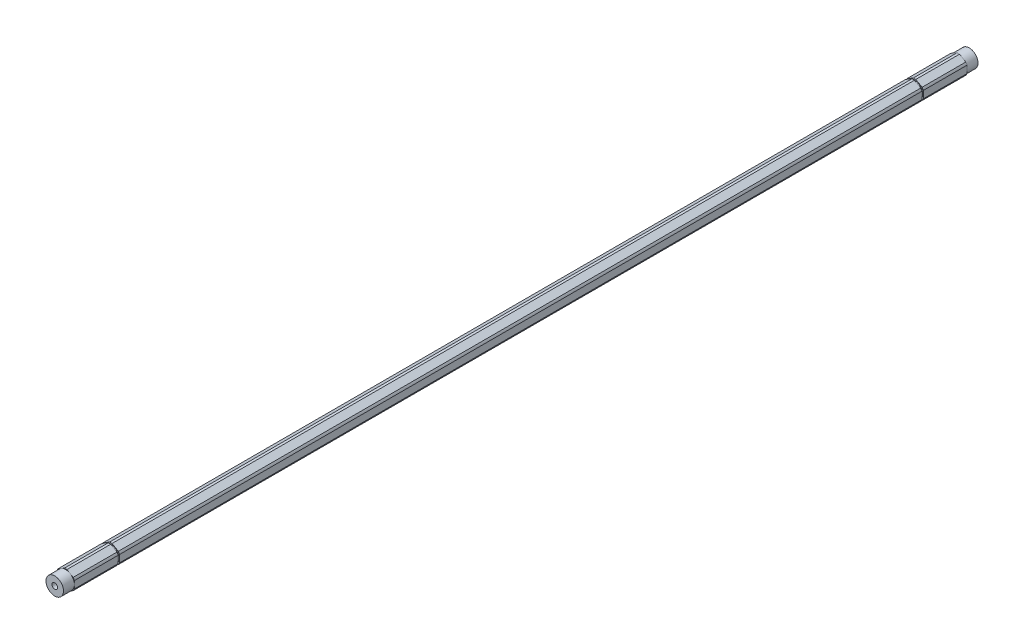
from build123d import *

# Parameters (mm, degrees)
SKETCH1_R                            = 2.0193
BOSS_EXTRUDE1_DEPTH                  = 331.7875
SKETCH2_R                            = 8.89
SKETCH2_R_2                          = 6.35
CUT_EXTRUDE_THIN1_DEPTH              = 7.9375
SKETCH3_W                            = 2.67360648
SKETCH3_H                            = 0.9906
F_10_32_TAPPED_HOLE1_D               = 4.0386
F_10_32_TAPPED_HOLE1_DEPTH           = 12.02944
F_10_32_TAPPED_HOLE1_TIP             = 1.213317848
F_10_32_TAPPED_HOLE1_ON_FACE_2_D     = 4.0386
F_10_32_TAPPED_HOLE1_ON_FACE_2_DEPTH = 12.02944
F_10_32_TAPPED_HOLE1_ON_FACE_2_TIP   = 1.213317848


with BuildPart() as part:
    # Sketch1 → Boss-Extrude1 (new, symmetric)
    with BuildSketch(Plane.XY):
        with BuildLine():
            ThreePointArc((0.893039571, 6.816751782), (0, 6.874999966), (-0.893039571, 6.816751782))
            Line((-0.893039571, 6.816751782), (-5.456960429, 4.181770846))
            ThreePointArc((-5.456960429, 4.181770846), (-5.953924622, 3.437499983), (-6.35, 2.634980936))
            Line((-6.35, 2.634980936), (-6.35, -2.634980936))
            ThreePointArc((-6.35, -2.634980936), (-5.953924622, -3.437499983), (-5.456960429, -4.181770846))
            Line((-5.456960429, -4.181770846), (-0.893039571, -6.816751782))
            ThreePointArc((-0.893039571, -6.816751782), (0, -6.874999966), (0.893039571, -6.816751782))
            Line((0.893039571, -6.816751782), (5.456960429, -4.181770846))
            ThreePointArc((5.456960429, -4.181770846), (5.953924622, -3.437499983), (6.35, -2.634980936))
            Line((6.35, -2.634980936), (6.35, 2.634980936))
            ThreePointArc((6.35, 2.634980936), (5.953924622, 3.437499983), (5.456960429, 4.181770846))
            Line((5.456960429, 4.181770846), (0.893039571, 6.816751782))
        make_face()
        Circle(SKETCH1_R, mode=Mode.SUBTRACT)
    extrude(amount=BOSS_EXTRUDE1_DEPTH, both=True)

    # Sketch2 → Cut-Extrude-Thin1 (cut)
    with BuildSketch(Plane(origin=(0, 0, -331.7875), x_dir=(-1, 0, 0), z_dir=(0, 0, -1))):
        Circle(SKETCH2_R)
        Circle(SKETCH2_R_2, mode=Mode.SUBTRACT)
    cut_extrude_thin1 = extrude(amount=-CUT_EXTRUDE_THIN1_DEPTH, mode=Mode.SUBTRACT)

    # Sketch3 → Cut-Revolve4 (revolve, cut)
    with BuildSketch(Plane(origin=(0, 0, 0), x_dir=(1, 0, 0), z_dir=(0, 1, 0))):
        with Locations((7.28040324, 291.6047)):
            Rectangle(SKETCH3_W, SKETCH3_H)
    cut_revolve4 = revolve(axis=Axis((0, 0, -323.85), (0, 0, -1)), mode=Mode.SUBTRACT)

    # Mirror1: Cut-Extrude-Thin1, Cut-Revolve4 across plane
    add(cut_extrude_thin1.mirror(Plane.XY), mode=Mode.SUBTRACT)
    add(cut_revolve4.mirror(Plane.XY), mode=Mode.SUBTRACT)

    # #10-32 Tapped Hole1
    with Locations(Plane(origin=(0, 0, -331.7875), x_dir=(-1, 0, 0), z_dir=(0, 0, -1))):
        with Locations((0, 0)):
            Hole(F_10_32_TAPPED_HOLE1_D / 2, depth=F_10_32_TAPPED_HOLE1_DEPTH)
            with Locations((0, 0, -(F_10_32_TAPPED_HOLE1_DEPTH + F_10_32_TAPPED_HOLE1_TIP / 2))):  # 118° drill point
                Cone(0, F_10_32_TAPPED_HOLE1_D / 2, F_10_32_TAPPED_HOLE1_TIP, mode=Mode.SUBTRACT)

    # #10-32 Tapped Hole1 on face 2
    with Locations(Plane(origin=(0, 0, 331.7875), x_dir=(-1, 0, 0), z_dir=(0, 0, -1))):
        with Locations((0, 0)):
            Hole(F_10_32_TAPPED_HOLE1_ON_FACE_2_D / 2, depth=F_10_32_TAPPED_HOLE1_ON_FACE_2_DEPTH)
            with Locations((0, 0, -(F_10_32_TAPPED_HOLE1_ON_FACE_2_DEPTH + F_10_32_TAPPED_HOLE1_ON_FACE_2_TIP / 2))):  # 118° drill point
                Cone(0, F_10_32_TAPPED_HOLE1_ON_FACE_2_D / 2, F_10_32_TAPPED_HOLE1_ON_FACE_2_TIP, mode=Mode.SUBTRACT)


solid = part.part
